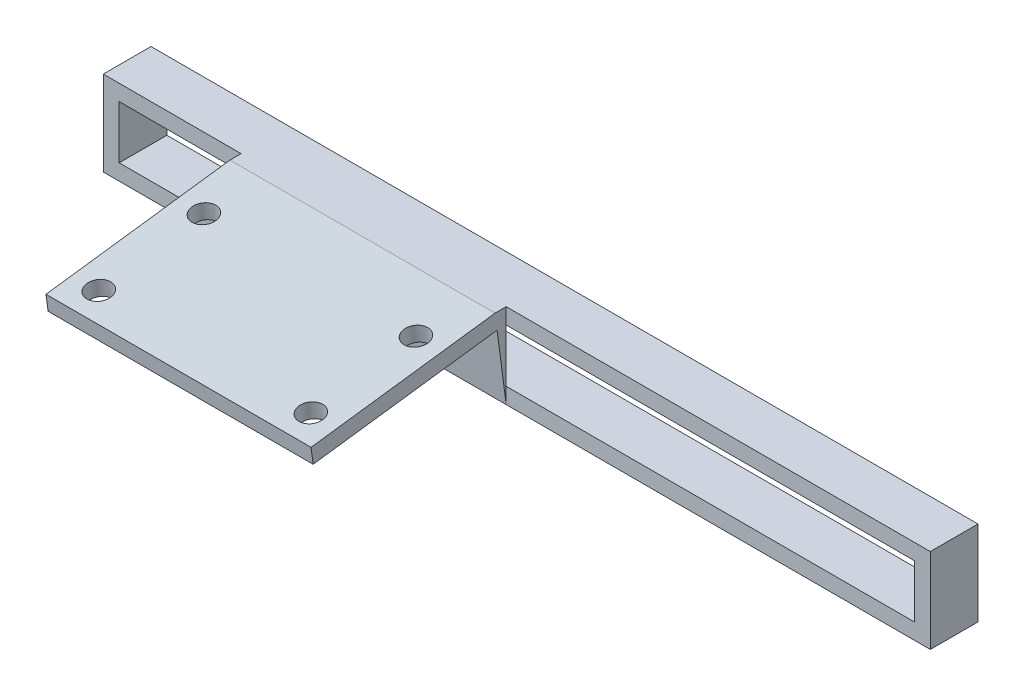
from build123d import *

# Parameters (mm, degrees)
SKETCH1_W            = 156
SKETCH1_H            = 16
BOSS_EXTRUDE1_DEPTH  = 9
SKETCH2_W            = 150
SKETCH2_H            = 10
CUT_EXTRUDE1_DEPTH   = 9
BOSS_EXTRUDE2_START  = -130
BOSS_EXTRUDE2_DEPTH  = 50
SKETCH5_W            = 50
SKETCH5_H            = 3
BOSS_EXTRUDE3_DEPTH  = 35
M4_CLEARANCE_HOLE1_D = 4.5


with BuildPart() as part:
    # Sketch1 → Boss-Extrude1 (new body)
    with BuildSketch(Plane.XY):
        with Locations((78, 8)):
            Rectangle(SKETCH1_W, SKETCH1_H)
    extrude(amount=BOSS_EXTRUDE1_DEPTH)

    # Sketch2 → Cut-Extrude1 (cut)
    with BuildSketch(Plane.XY.offset(9)):
        with Locations((78, 8)):
            Rectangle(SKETCH2_W, SKETCH2_H)
    extrude(amount=-CUT_EXTRUDE1_DEPTH, mode=Mode.SUBTRACT)

    # Sketch4 → Boss-Extrude2 (add)
    with BuildSketch(Plane(origin=(156, 0, 0), x_dir=(0, 0, -1), z_dir=(1, 0, 0)).offset(BOSS_EXTRUDE2_START)):
        Polygon((-9, 16), (-11.106439961, 16), (-9, 0), align=None)
    extrude(amount=BOSS_EXTRUDE2_DEPTH)

    # Sketch5 → Boss-Extrude3 (add)
    with BuildSketch(Plane(origin=(0, -1.164685703, 8.846666218), x_dir=(1, 0, 0), z_dir=(0, -0.13052619222004497, 0.9914448613738114))):
        with Locations((51, 15.812799099)):
            Rectangle(SKETCH5_W, SKETCH5_H)
    extrude(amount=BOSS_EXTRUDE3_DEPTH)

    # M4 Clearance Hole1 (through all)
    with Locations(Plane(origin=(0, 17.164685703, 2.259773743), x_dir=(1, 0, 0), z_dir=(0, 0.9914448613738114, 0.130526192220045))):
        with Locations((31, -18.923003752), (71, -18.923003752), (71, -38.923003752), (31, -38.923003752)):
            Hole(M4_CLEARANCE_HOLE1_D / 2)


solid = part.part
